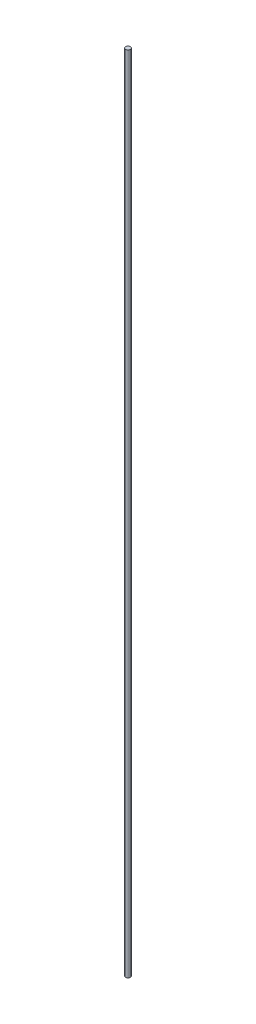
from build123d import *

# Parameters (mm, degrees)
SKETCH_2_W = 2.5
SKETCH_2_H = 839.82


with BuildPart() as part:
    # Эскиз2 → Повернуть1 (revolve)
    with BuildSketch(Plane.XY):
        with Locations((-1.25, -137.834292052)):
            Rectangle(SKETCH_2_W, SKETCH_2_H)
    revolve(axis=Axis((-2.5, 282.075707948, 0), (0, -1, 0)))


solid = part.part
